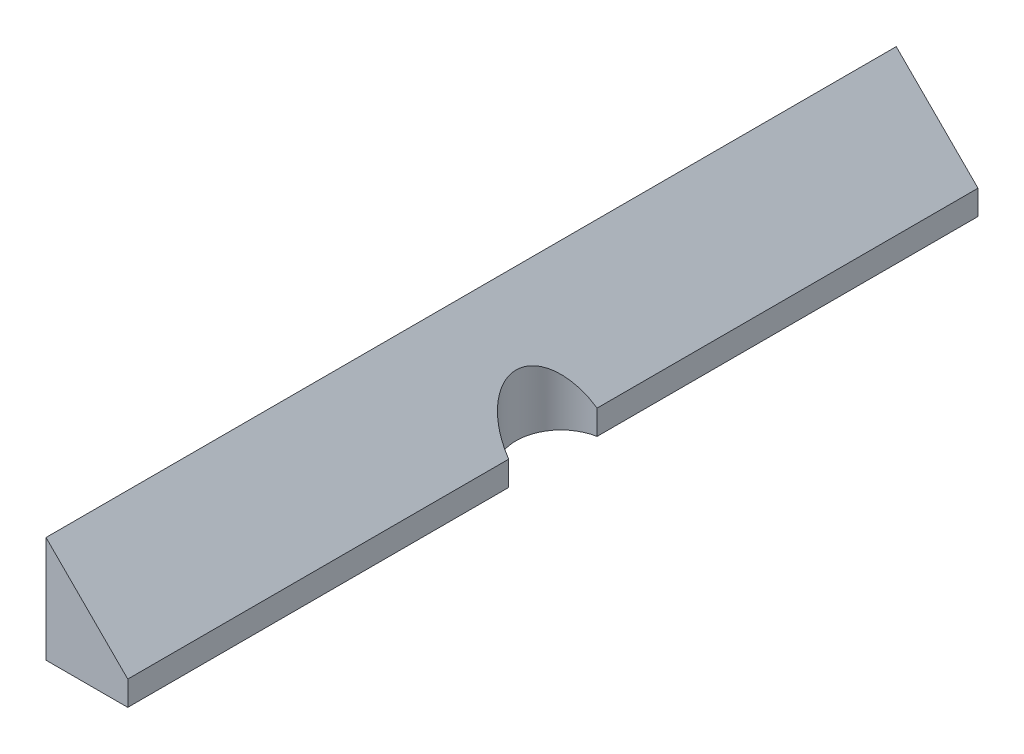
from build123d import *

# Parameters (mm, degrees)
BOSS_EXTRUDE1_DEPTH = 10.4
CUT_EXTRUDE1_REACH  = 12.905
SKETCH2_R           = 1.1


with BuildPart() as part:
    # Sketch1 → Boss-Extrude1 (new, symmetric)
    with BuildSketch(Plane.XY):
        Polygon((0, 2.6), (0, 0), (2, 0), (2, 0.6), align=None)
    extrude(amount=BOSS_EXTRUDE1_DEPTH, both=True)

    # Cut-Extrude1: up to this face of the body (flat: up to its plane)
    cut_extrude1_end = Plane(part.part.faces().sort_by_distance((1, 1.6, 0))[0])
    # Sketch2 → Cut-Extrude1 (cut, up to the picked face)
    with BuildSketch(Plane.XZ, mode=Mode.PRIVATE) as cut_extrude1_sk1:
        with Locations((2.2, 0)):
            Circle(SKETCH2_R)
    cut_extrude1_tool1 = split(extrude(cut_extrude1_sk1.sketch, amount=-CUT_EXTRUDE1_REACH, mode=Mode.PRIVATE), bisect_by=cut_extrude1_end, keep=Keep.BOTH, mode=Mode.PRIVATE)
    # Sketch2 → Cut-Extrude1 (cut, up to the picked face)
    with BuildSketch(Plane.XZ, mode=Mode.PRIVATE) as cut_extrude1_sk2:
        with Locations((2.2, 22)):
            Circle(SKETCH2_R)
    cut_extrude1_tool2 = split(extrude(cut_extrude1_sk2.sketch, amount=-CUT_EXTRUDE1_REACH, mode=Mode.PRIVATE), bisect_by=cut_extrude1_end, keep=Keep.BOTH, mode=Mode.PRIVATE)
    # Sketch2 → Cut-Extrude1 (cut, up to the picked face)
    with BuildSketch(Plane.XZ, mode=Mode.PRIVATE) as cut_extrude1_sk3:
        with Locations((2.2, -22)):
            Circle(SKETCH2_R)
    cut_extrude1_tool3 = split(extrude(cut_extrude1_sk3.sketch, amount=-CUT_EXTRUDE1_REACH, mode=Mode.PRIVATE), bisect_by=cut_extrude1_end, keep=Keep.BOTH, mode=Mode.PRIVATE)
    add(cut_extrude1_tool1.solids().sort_by(Axis((2.2, 0, 0), (0, 1, 0)))[0], mode=Mode.SUBTRACT)
    add(cut_extrude1_tool2.solids().sort_by(Axis((2.2, 0, 22), (0, 1, 0)))[0], mode=Mode.SUBTRACT)
    add(cut_extrude1_tool3.solids().sort_by(Axis((2.2, 0, -22), (0, 1, 0)))[0], mode=Mode.SUBTRACT)


solid = part.part
